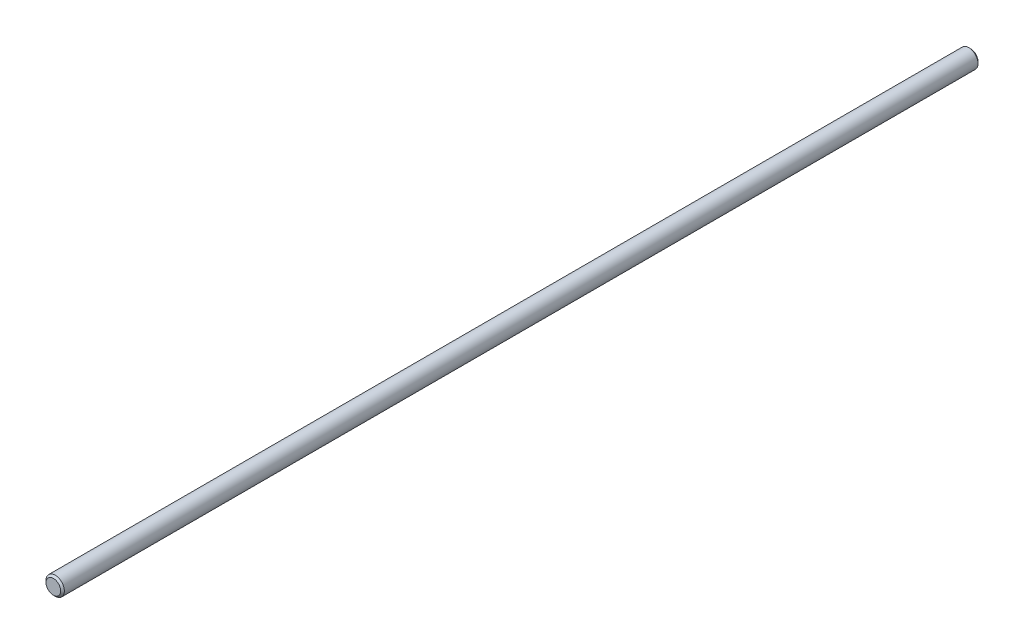
from build123d import *

# Parameters (mm, degrees)
SKETCH1_R      = 4
EXTRUDE1_DEPTH = 200
CHAMFER1_SIZE  = 0.8


with BuildPart() as part:
    # Sketch1 → Extrude1 (new, symmetric)
    with BuildSketch(Plane.XY):
        Circle(SKETCH1_R)
    extrude(amount=EXTRUDE1_DEPTH, both=True)

    # Chamfer1
    chamfer1_edges = [part.edges().sort_by_distance(p)[0] for p in [
        (-4, 0, -200),
        (-4, 0, 200),
    ]]
    chamfer(chamfer1_edges, length=CHAMFER1_SIZE)


solid = part.part
